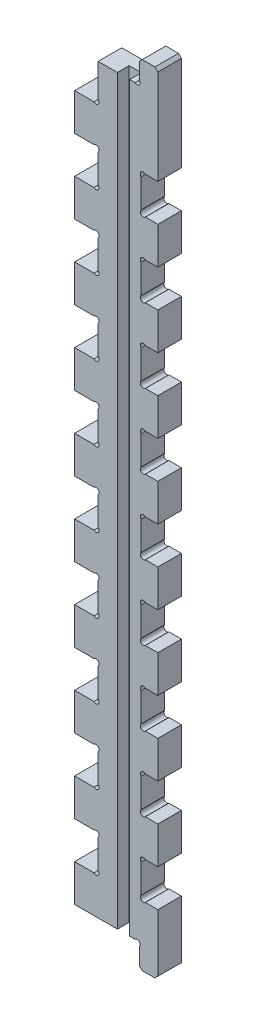
from build123d import *

# Parameters (mm, degrees)
BOSS_EXTRUDE1_DEPTH = 6.35
CUT_EXTRUDE1_DEPTH  = 3.175
CHAMFER1_SIZE       = 0.79375
SKETCH5_W           = 3.302
SKETCH5_H           = 3.175
CUT_EXTRUDE4_DEPTH  = 208.663320883


# Read off the part's stored shape, not the designer's step: Boss-Extrude1
with BuildPart() as part:
    # Boss-Extrude1 outline → Boss-Extrude1 (new body)
    with BuildSketch(Plane.XY):
        with BuildLine():
            Line((22.436796564, 150), (19.069200519, 150))
            ThreePointArc((19.069200519, 150), (17.946668504, 150), (17.946668504, 151.122532015))
            Line((17.946668504, 151.122532015), (17.946668504, 158.877467985))
            ThreePointArc((17.946668504, 158.877467985), (17.946668504, 160), (19.069200519, 160))
            Line((19.069200519, 160), (22.436796564, 160))
            Line((22.436796564, 160), (22.436796564, 170))
            Line((22.436796564, 170), (19.069200519, 170))
            ThreePointArc((19.069200519, 170), (17.946668504, 170), (17.946668504, 171.122532015))
            Line((17.946668504, 171.122532015), (17.946668504, 178.877467985))
            ThreePointArc((17.946668504, 178.877467985), (17.946668504, 180), (19.069200519, 180))
            Line((19.069200519, 180), (22.436796564, 180))
            Line((22.436796564, 180), (22.436796564, 206.35))
            Line((22.436796564, 206.35), (17.436796564, 206.35))
            Line((17.436796564, 206.35), (17.436796564, 201.122532015))
            ThreePointArc((17.436796564, 201.122532015), (17.436796564, 200), (16.314264549, 200))
            Line((16.314264549, 200), (6.35, 200))
            Line((6.35, 200), (6.35, 191.122532015))
            ThreePointArc((6.35, 191.122532015), (6.35, 190), (5.227467985, 190))
            Line((5.227467985, 190), (0, 190))
            Line((0, 190), (0, 180))
            Line((0, 180), (5.227467985, 180))
            ThreePointArc((5.227467985, 180), (6.35, 180), (6.35, 178.877467985))
            Line((6.35, 178.877467985), (6.35, 171.122532015))
            ThreePointArc((6.35, 171.122532015), (6.35, 170), (5.227467985, 170))
            Line((5.227467985, 170), (0, 170))
            Line((0, 170), (0, 160))
            Line((0, 160), (5.227467985, 160))
            ThreePointArc((5.227467985, 160), (6.35, 160), (6.35, 158.877467985))
            Line((6.35, 158.877467985), (6.35, 151.122532015))
            ThreePointArc((6.35, 151.122532015), (6.35, 150), (5.227467985, 150))
            Line((5.227467985, 150), (0, 150))
            Line((0, 150), (0, 140))
            Line((0, 140), (5.227467985, 140))
            ThreePointArc((5.227467985, 140), (6.35, 140), (6.35, 138.877467985))
            Line((6.35, 138.877467985), (6.35, 131.122532015))
            ThreePointArc((6.35, 131.122532015), (6.35, 130), (5.227467985, 130))
            Line((5.227467985, 130), (0, 130))
            Line((0, 130), (0, 120))
            Line((0, 120), (5.227467985, 120))
            ThreePointArc((5.227467985, 120), (6.35, 120), (6.35, 118.877467985))
            Line((6.35, 118.877467985), (6.35, 111.122532015))
            ThreePointArc((6.35, 111.122532015), (6.35, 110), (5.227467985, 110))
            Line((5.227467985, 110), (0, 110))
            Line((0, 110), (0, 100))
            Line((0, 100), (5.227467985, 100))
            ThreePointArc((5.227467985, 100), (6.35, 100), (6.35, 98.877467985))
            Line((6.35, 98.877467985), (6.35, 91.122532015))
            ThreePointArc((6.35, 91.122532015), (6.35, 90), (5.227467985, 90))
            Line((5.227467985, 90), (0, 90))
            Line((0, 90), (0, 80))
            Line((0, 80), (5.227467985, 80))
            ThreePointArc((5.227467985, 80), (6.35, 80), (6.35, 78.877467985))
            Line((6.35, 78.877467985), (6.35, 71.122532015))
            ThreePointArc((6.35, 71.122532015), (6.35, 70), (5.227467985, 70))
            Line((5.227467985, 70), (0, 70))
            Line((0, 70), (0, 60))
            Line((0, 60), (5.227467985, 60))
            ThreePointArc((5.227467985, 60), (6.35, 60), (6.35, 58.877467985))
            Line((6.35, 58.877467985), (6.35, 51.122532015))
            ThreePointArc((6.35, 51.122532015), (6.35, 50), (5.227467985, 50))
            Line((5.227467985, 50), (0, 50))
            Line((0, 50), (0, 40))
            Line((0, 40), (5.227467985, 40))
            ThreePointArc((5.227467985, 40), (6.35, 40), (6.35, 38.877467985))
            Line((6.35, 38.877467985), (6.35, 31.122532015))
            ThreePointArc((6.35, 31.122532015), (6.35, 30), (5.227467985, 30))
            Line((5.227467985, 30), (0, 30))
            Line((0, 30), (0, 20))
            Line((0, 20), (5.227467985, 20))
            ThreePointArc((5.227467985, 20), (6.35, 20), (6.35, 18.877467985))
            Line((6.35, 18.877467985), (6.35, 11.122532015))
            ThreePointArc((6.35, 11.122532015), (6.35, 10), (5.227467985, 10))
            Line((5.227467985, 10), (0, 10))
            Line((0, 10), (0, 0))
            Line((0, 0), (16.314264549, 0))
            ThreePointArc((16.314264549, 0), (17.436796564, 0), (17.436796564, -1.122532015))
            Line((17.436796564, -1.122532015), (17.436796564, -6.35))
            Line((17.436796564, -6.35), (22.436796564, -6.35))
            Line((22.436796564, -6.35), (22.436796564, 10))
            Line((22.436796564, 10), (19.069200519, 10))
            ThreePointArc((19.069200519, 10), (17.946668504, 10), (17.946668504, 11.122532015))
            Line((17.946668504, 11.122532015), (17.946668504, 18.877467985))
            ThreePointArc((17.946668504, 18.877467985), (17.946668504, 20), (19.069200519, 20))
            Line((19.069200519, 20), (22.436796564, 20))
            Line((22.436796564, 20), (22.436796564, 30))
            Line((22.436796564, 30), (19.069200519, 30))
            ThreePointArc((19.069200519, 30), (17.946668504, 30), (17.946668504, 31.122532015))
            Line((17.946668504, 31.122532015), (17.946668504, 38.877467985))
            ThreePointArc((17.946668504, 38.877467985), (17.946668504, 40), (19.069200519, 40))
            Line((19.069200519, 40), (22.436796564, 40))
            Line((22.436796564, 40), (22.436796564, 50))
            Line((22.436796564, 50), (19.069200519, 50))
            ThreePointArc((19.069200519, 50), (17.946668504, 50), (17.946668504, 51.122532015))
            Line((17.946668504, 51.122532015), (17.946668504, 58.877467985))
            ThreePointArc((17.946668504, 58.877467985), (17.946668504, 60), (19.069200519, 60))
            Line((19.069200519, 60), (22.436796564, 60))
            Line((22.436796564, 60), (22.436796564, 70))
            Line((22.436796564, 70), (19.069200519, 70))
            ThreePointArc((19.069200519, 70), (17.946668504, 70), (17.946668504, 71.122532015))
            Line((17.946668504, 71.122532015), (17.946668504, 78.877467985))
            ThreePointArc((17.946668504, 78.877467985), (17.946668504, 80), (19.069200519, 80))
            Line((19.069200519, 80), (22.436796564, 80))
            Line((22.436796564, 80), (22.436796564, 90))
            Line((22.436796564, 90), (19.069200519, 90))
            ThreePointArc((19.069200519, 90), (17.946668504, 90), (17.946668504, 91.122532015))
            Line((17.946668504, 91.122532015), (17.946668504, 98.877467985))
            ThreePointArc((17.946668504, 98.877467985), (17.946668504, 100), (19.069200519, 100))
            Line((19.069200519, 100), (22.436796564, 100))
            Line((22.436796564, 100), (22.436796564, 110))
            Line((22.436796564, 110), (19.069200519, 110))
            ThreePointArc((19.069200519, 110), (17.946668504, 110), (17.946668504, 111.122532015))
            Line((17.946668504, 111.122532015), (17.946668504, 118.877467985))
            ThreePointArc((17.946668504, 118.877467985), (17.946668504, 120), (19.069200519, 120))
            Line((19.069200519, 120), (22.436796564, 120))
            Line((22.436796564, 120), (22.436796564, 130))
            Line((22.436796564, 130), (19.069200519, 130))
            ThreePointArc((19.069200519, 130), (17.946668504, 130), (17.946668504, 131.122532015))
            Line((17.946668504, 131.122532015), (17.946668504, 138.877467985))
            ThreePointArc((17.946668504, 138.877467985), (17.946668504, 140), (19.069200519, 140))
            Line((19.069200519, 140), (22.436796564, 140))
            Line((22.436796564, 140), (22.436796564, 150))
        make_face()
    extrude(amount=BOSS_EXTRUDE1_DEPTH)

    # Sketch2 → Cut-Extrude1 (cut)
    with BuildSketch(Plane.XY.offset(6.35)):
        Polygon((14.771668504, -1.25), (11.596668504, -1.25), (11.596668504, 200), (11.596668504, 201.5875), (14.771668504, 201.5875), (14.771668504, 0), align=None)
    extrude(amount=-CUT_EXTRUDE1_DEPTH, mode=Mode.SUBTRACT)

    # Chamfer1
    chamfer1_edges = [part.edges().sort_by_distance(p)[0] for p in [
        (22.436796564, -6.35, 3.175),
        (17.436796564, -6.35, 3.175),
        (17.436796564, 206.35, 3.175),
        (22.436796564, 206.35, 3.175),
    ]]
    chamfer(chamfer1_edges, length=CHAMFER1_SIZE)

    # Sketch5 → Cut-Extrude4 (cut, through all)
    with BuildSketch(Plane(origin=(0, 200, 0), x_dir=(1, 0, 0), z_dir=(0, 1, 0))):
        with Locations((13.184168504, -4.7625)):
            Rectangle(SKETCH5_W, SKETCH5_H)
    extrude(amount=-CUT_EXTRUDE4_DEPTH, mode=Mode.SUBTRACT)


solid = part.part
